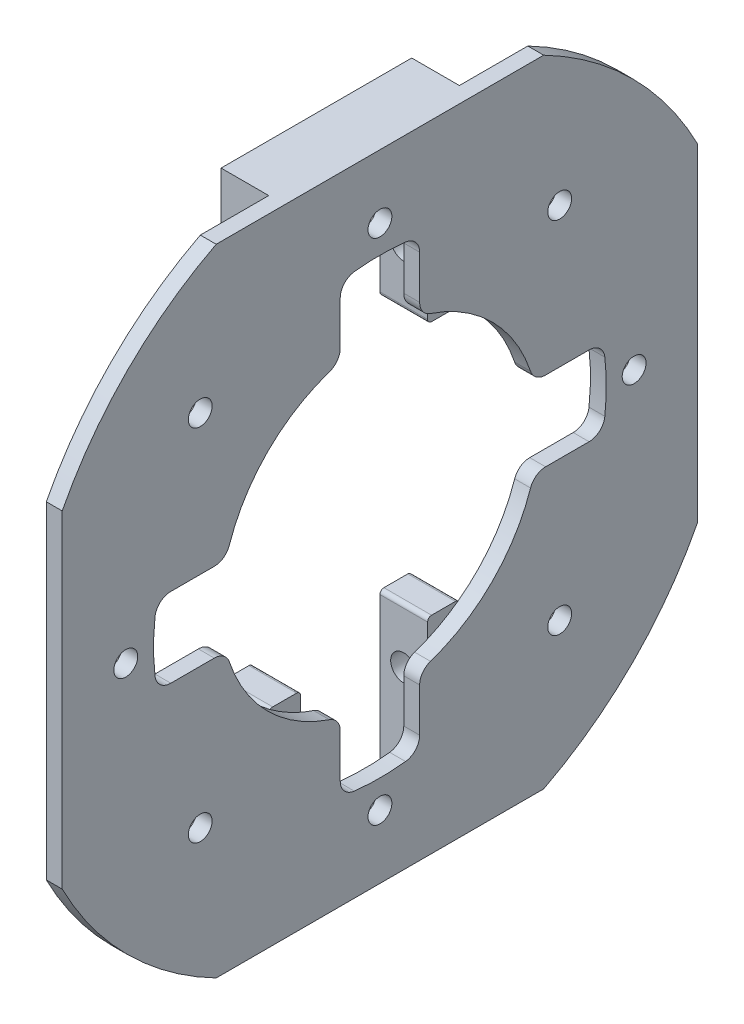
from build123d import *

# Parameters (mm, degrees)
EXTRUDE_1_DEPTH                  = 2
CUT_EXTRUDE_1_DEPTH              = 57.603886792
EXTRUDE_2_DEPTH                  = 6
EXTRUDE_3_DEPTH                  = 6
SKETCH_5_W                       = 1.65
SKETCH_5_H                       = 32
HOLE_WIZARD_3_3_3_3_1_AT_2_COUNT = 2
HOLE_WIZARD_3_3_3_3_1_AT_2_PITCH = 46
HOLE_WIZARD_3_3_3_3_2_D          = 3.3
HOLE_WIZARD_3_3_3_3_2_DEPTH      = 52
HOLE_WIZARD_3_0_3_1_D            = 3
HOLE_WIZARD_3_0_3_1_DEPTH        = 8
FILLET_1_R                       = 0.5
FILLET_2_R                       = 2


with BuildPart() as part:
    # 草图1 → 凸台-拉伸1 (new body)
    with BuildSketch(Plane(origin=(62, 0, 0), x_dir=(0, 0, -1), z_dir=(1, 0, 0))):
        with BuildLine():
            Line((20.615528128, 40), (-20.615528128, 40))
            ThreePointArc((-20.615528128, 40), (-31.819805153, 31.819805153), (-40, 20.615528128))
            Line((-40, 20.615528128), (-40, -20.615528128))
            ThreePointArc((-40, -20.615528128), (-31.819805153, -31.819805153), (-20.615528128, -40))
            Line((-20.615528128, -40), (20.615528128, -40))
            ThreePointArc((20.615528128, -40), (31.819805153, -31.819805153), (40, -20.615528128))
            Line((40, -20.615528128), (40, 20.615528128))
            ThreePointArc((40, 20.615528128), (31.819805153, 31.819805153), (20.615528128, 40))
        make_face()
    extrude(amount=-EXTRUDE_1_DEPTH)

    # 草图2 → 切除-拉伸1 (cut, through all)
    with BuildSketch(Plane.ZY.offset(-60)):
        with BuildLine():
            Line((5, -28.057975693), (5, -19.364916731))
            ThreePointArc((5, -19.364916731), (14.142135624, -14.142135624), (19.364916731, -5))
            Line((19.364916731, -5), (28.057975693, -5))
            ThreePointArc((28.057975693, -5), (28.5, 0), (28.057975693, 5))
            Line((28.057975693, 5), (19.364916731, 5))
            ThreePointArc((19.364916731, 5), (14.142135624, 14.142135624), (5, 19.364916731))
            Line((5, 19.364916731), (5, 28.057975693))
            ThreePointArc((5, 28.057975693), (0, 28.5), (-5, 28.057975693))
            Line((-5, 28.057975693), (-5, 19.364916731))
            ThreePointArc((-5, 19.364916731), (-14.142135624, 14.142135624), (-19.364916731, 5))
            Line((-19.364916731, 5), (-28.057975693, 5))
            ThreePointArc((-28.057975693, 5), (-28.5, 0), (-28.057975693, -5))
            Line((-28.057975693, -5), (-19.364916731, -5))
            ThreePointArc((-19.364916731, -5), (-14.142135624, -14.142135624), (-5, -19.364916731))
            Line((-5, -19.364916731), (-5, -28.057975693))
            ThreePointArc((-5, -28.057975693), (0, -28.5), (5, -28.057975693))
        make_face()
    extrude(amount=-CUT_EXTRUDE_1_DEPTH, mode=Mode.SUBTRACT)

    # 草图3 → 凸台-拉伸2 (add)
    with BuildSketch(Plane.ZY.offset(-60)):
        Polygon((12, -16), (12, -40), (-12, -40), (-12, -16), (-8, -16), (-8, -38), (8, -38), (8, -16), align=None)
    extrude(amount=EXTRUDE_2_DEPTH)

    # 草图4 → 凸台-拉伸3 (add)
    with BuildSketch(Plane.ZY.offset(-60)):
        Polygon((12, 16), (8, 16), (8, 38), (-8, 38), (-8, 16), (-12, 16), (-12, 40), (12, 40), align=None)
    extrude(amount=EXTRUDE_3_DEPTH)

    # 草图5 → Ø3.3 (3.3) 直径孔1 (revolve, cut)
    with BuildSketch(Plane(origin=(57, -23, 8), x_dir=(0, 1, 0), z_dir=(1, 0, 0))):
        with Locations((0.825, 16)):
            Rectangle(SKETCH_5_W, SKETCH_5_H)
    hole_wizard_3_3_3_3_1 = revolve(axis=Axis((57, -23, 1.65), (0, 0, 1)), mode=Mode.SUBTRACT)

    # Ø3.3 (3.3) 直径孔1 at 2: Ø3.3 (3.3) 直径孔1 ×2
    with Locations(*[(0, i * HOLE_WIZARD_3_3_3_3_1_AT_2_PITCH, 0) for i in range(1, HOLE_WIZARD_3_3_3_3_1_AT_2_COUNT)]):
        add(hole_wizard_3_3_3_3_1, mode=Mode.SUBTRACT)

    # Ø3.3 (3.3) 直径孔2
    with Locations(Plane(origin=(0, 0, -12), x_dir=(-1, 0, 0), z_dir=(0, 0, -1))):
        with Locations((-57, -23), (-57, 23)):
            Hole(HOLE_WIZARD_3_3_3_3_2_D / 2, depth=HOLE_WIZARD_3_3_3_3_2_DEPTH)

    # Ø3.0 (3) 直径孔1
    with Locations(Plane(origin=(62, 0, 0), x_dir=(0, 0, -1), z_dir=(1, 0, 0))):
        with Locations((0, 32), (-22.627416998, 22.627416998), (-32, 0), (-22.627416998, -22.627416998), (0, -32), (22.627416998, -22.627416998), (32, 0), (22.627416998, 22.627416998)):
            Hole(HOLE_WIZARD_3_0_3_1_D / 2, depth=HOLE_WIZARD_3_0_3_1_DEPTH)

    # 圆角1
    # the kernel refuses this fillet: 0.5 mm, written as the material it adds along each edge
    with BuildSketch(Plane(origin=(61.25, 38, -8), x_dir=(0, 0, 1), z_dir=(-1, 0, 0)), Plane(origin=(61.25, 38, 8), x_dir=(0, -1, 0), z_dir=(-1, 0, 0)), Plane(origin=(61.25, -38, 8), x_dir=(0, 0, -1), z_dir=(-1, 0, 0)), Plane(origin=(61.25, -38, -8), x_dir=(0, 1, 0), z_dir=(-1, 0, 0))) as fillet_1_piece_1:
        with BuildLine():
            CenterArc((FILLET_1_R, -FILLET_1_R), FILLET_1_R, 90, 90)
            Line((0, -FILLET_1_R), (0, 0))
            Line((0, 0), (FILLET_1_R, 0))
        make_face()
    extrude(amount=7.25)
    # the kernel refuses this fillet: 0.5 mm, written as the material it takes off along each edge
    with BuildSketch(Plane(origin=(60, 16, 12), x_dir=(0, 1, 0), z_dir=(-1, 0, 0)), Plane(origin=(60, -16, -12), x_dir=(0, -1, 0), z_dir=(-1, 0, 0))) as fillet_1_2_piece_1:
        with BuildLine():
            CenterArc((FILLET_1_R, FILLET_1_R), FILLET_1_R, 180, 90)
            Line((0, FILLET_1_R), (0, 0))
            Line((0, 0), (FILLET_1_R, 0))
        make_face()
    extrude(amount=7.25, mode=Mode.SUBTRACT)
    with BuildSketch(Plane(origin=(60, 16, -12), x_dir=(0, 1, 0), z_dir=(-1, 0, 0)), Plane(origin=(60, -16, 12), x_dir=(0, -1, 0), z_dir=(-1, 0, 0))) as fillet_1_2_piece_2:
        with BuildLine():
            CenterArc((FILLET_1_R, -FILLET_1_R), FILLET_1_R, 90, 90)
            Line((0, -FILLET_1_R), (0, 0))
            Line((0, 0), (FILLET_1_R, 0))
        make_face()
    extrude(amount=7.25, mode=Mode.SUBTRACT)
    with BuildSketch(Plane(origin=(61.25, 16, -8), x_dir=(0, 0, -1), z_dir=(-1, 0, 0)), Plane(origin=(61.25, -16, 8), x_dir=(0, 0, 1), z_dir=(-1, 0, 0))) as fillet_1_2_piece_3:
        with BuildLine():
            CenterArc((FILLET_1_R, -FILLET_1_R), FILLET_1_R, 90, 90)
            Line((0, -FILLET_1_R), (0, 0))
            Line((0, 0), (FILLET_1_R, 0))
        make_face()
    extrude(amount=8.5, mode=Mode.SUBTRACT)
    with BuildSketch(Plane(origin=(61.25, 16, 8), x_dir=(0, 0, 1), z_dir=(-1, 0, 0)), Plane(origin=(61.25, -16, -8), x_dir=(0, 0, -1), z_dir=(-1, 0, 0))) as fillet_1_2_piece_4:
        with BuildLine():
            CenterArc((FILLET_1_R, FILLET_1_R), FILLET_1_R, 180, 90)
            Line((0, FILLET_1_R), (0, 0))
            Line((0, 0), (FILLET_1_R, 0))
        make_face()
    extrude(amount=8.5, mode=Mode.SUBTRACT)

    # 圆角2
    fillet_2_edges = [part.edges().sort_by_distance(p)[0] for p in [
        (61, -28.057975693, 5),
        (61, -28.057975693, -5),
        (61, -19.364916731, -5),
        (61, -5, -19.364916731),
        (61, -5, -28.057975693),
        (61, 5, -28.057975693),
        (61, 5, -19.364916731),
        (61, 19.364916731, -5),
        (61, 28.057975693, -5),
        (61, 28.057975693, 5),
        (61, 19.364916731, 5),
        (61, 5, 19.364916731),
        (61, 5, 28.057975693),
        (61, -5, 28.057975693),
        (61, -5, 19.364916731),
        (61, -19.364916731, 5),
    ]]
    fillet(fillet_2_edges, radius=FILLET_2_R)


solid = part.part
